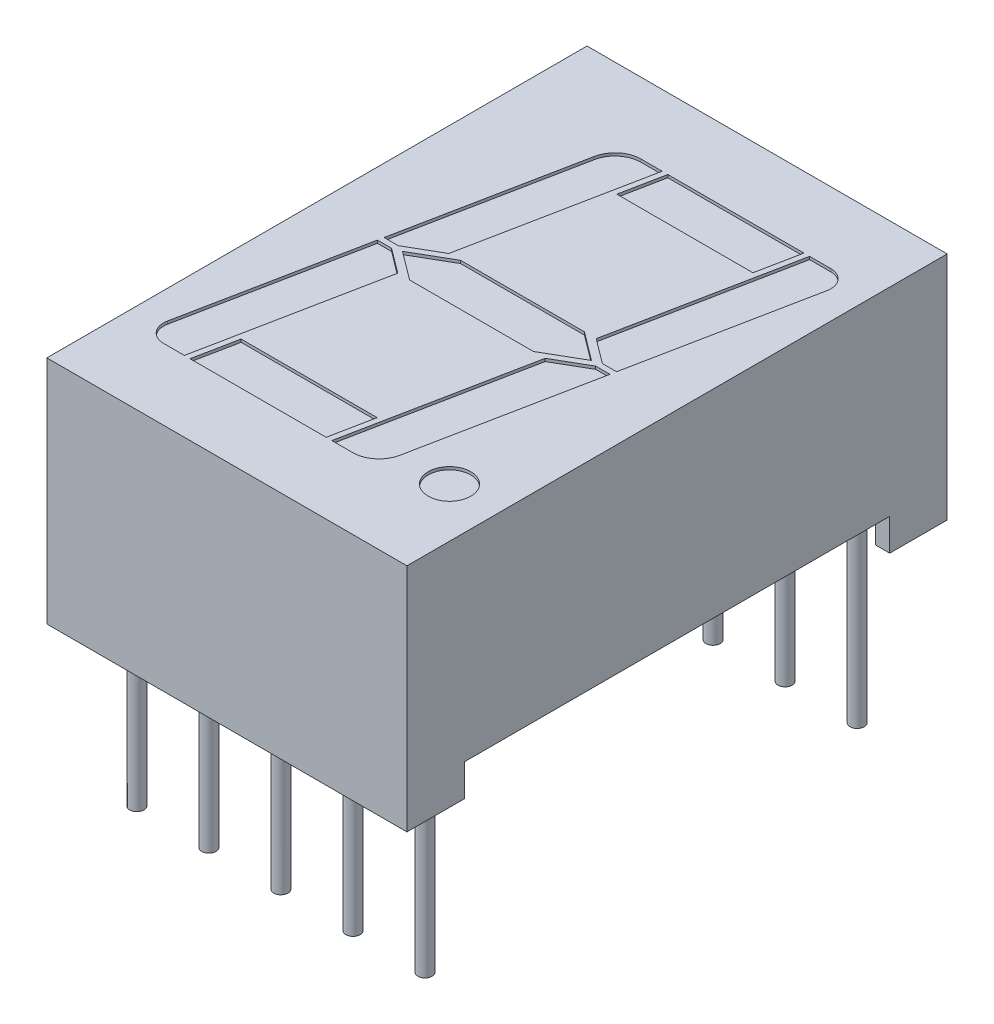
from build123d import *

# Parameters (mm, degrees)
SKETCH1_W                      = 12.7
SKETCH1_H                      = 19.05
BOSS_EXTRUDE1_DEPTH            = 8.128
SKETCH2_W                      = 15
SKETCH2_H                      = 1.128
CUT_EXTRUDE1_DEPTH             = 12.7
SKETCH3_W                      = 11.7
SKETCH3_H                      = 18.05
CUT_EXTRUDE2_DEPTH             = 0.5
CUT_EXTRUDE2_DIRECTION_2_REACH = 15.418
FILLET1_R                      = 1
FILLET2_R                      = 0.1
SKETCH4_R                      = 0.75
CUT_EXTRUDE3_DEPTH             = 0.1
SKETCH5_R                      = 0.25
BOSS_EXTRUDE2_DEPTH            = 7.5


with BuildPart() as part:
    # Sketch1 → Boss-Extrude1 (new body)
    with BuildSketch(Plane(origin=(0, 0, 0), x_dir=(1, 0, 0), z_dir=(0, 1, 0))):
        Rectangle(SKETCH1_W, SKETCH1_H)
    extrude(amount=-BOSS_EXTRUDE1_DEPTH)

    # Sketch2 → Cut-Extrude1 (cut)
    with BuildSketch(Plane(origin=(6.35, 0, 0), x_dir=(0, 0, -1), z_dir=(1, 0, 0))):
        with Locations((0, -7.564)):
            Rectangle(SKETCH2_W, SKETCH2_H)
    extrude(amount=-CUT_EXTRUDE1_DEPTH, mode=Mode.SUBTRACT)

    # Sketch3 → Cut-Extrude2 (cut)
    with BuildSketch(Plane.XZ.offset(7)):
        Rectangle(SKETCH3_W, SKETCH3_H)
    extrude(amount=-CUT_EXTRUDE2_DEPTH, mode=Mode.SUBTRACT)

    # Cut-Extrude2 direction 2: up to this face of the body (flat: up to its plane)
    cut_extrude2_direction_2_end = Plane(part.part.faces().sort_by_distance((0, -8.128, -8.5125))[0])
    # Sketch3 → Cut-Extrude2 direction 2 (cut, up to the picked face)
    with BuildSketch(Plane.XZ.offset(7), mode=Mode.PRIVATE) as cut_extrude2_direction_2_sk1:
        Rectangle(SKETCH3_W, SKETCH3_H)
    cut_extrude2_direction_2_tool1 = split(extrude(cut_extrude2_direction_2_sk1.sketch, amount=CUT_EXTRUDE2_DIRECTION_2_REACH, mode=Mode.PRIVATE), bisect_by=cut_extrude2_direction_2_end, keep=Keep.BOTH, mode=Mode.PRIVATE)
    add(cut_extrude2_direction_2_tool1.solids().sort_by(Axis((0, -7, 0), (0, -1, 0)))[0], mode=Mode.SUBTRACT)

    # Fillet1
    # the kernel refuses this fillet: 1 mm, written as the material it adds along each edge
    with BuildSketch(Plane(origin=(5.85, -6.5, 9.025), x_dir=(-1, 0, 0), z_dir=(0, 0, -1))) as fillet1_piece_1_section:
        with BuildLine():
            CenterArc((FILLET1_R, -FILLET1_R), FILLET1_R, 90, 90)
            Line((0, -FILLET1_R), (0, 0))
            Line((0, 0), (FILLET1_R, 0))
        make_face()
    fillet1_piece_1 = extrude(amount=18.05, mode=Mode.PRIVATE)
    fillet1_piece_1 = split(fillet1_piece_1, bisect_by=Plane(origin=(5.59487994, -7, 8.2625), z_dir=(0, 1, 0)), keep=Keep.TOP, mode=Mode.PRIVATE)
    fillet1_piece_1 = split(fillet1_piece_1, bisect_by=Plane(origin=(5.59487994, -6.664391764, 7.5), z_dir=(0, 0, 1)), keep=Keep.TOP, mode=Mode.PRIVATE)
    add(fillet1_piece_1)
    with BuildSketch(Plane(origin=(5.85, -6.5, 9.025), x_dir=(-1, 0, 0), z_dir=(0, 0, -1))) as fillet1_piece_2_section:
        with BuildLine():
            CenterArc((FILLET1_R, -FILLET1_R), FILLET1_R, 90, 90)
            Line((0, -FILLET1_R), (0, 0))
            Line((0, 0), (FILLET1_R, 0))
        make_face()
    fillet1_piece_2 = extrude(amount=18.05, mode=Mode.PRIVATE)
    fillet1_piece_2 = split(fillet1_piece_2, bisect_by=Plane(origin=(5.825991618, -7, 8.2625), z_dir=(0, -1, 0)), keep=Keep.TOP, mode=Mode.PRIVATE)
    fillet1_piece_2 = split(fillet1_piece_2, bisect_by=Plane(origin=(5.825991618, -7.163250785, 7.5), z_dir=(0, 0, 1)), keep=Keep.TOP, mode=Mode.PRIVATE)
    add(fillet1_piece_2)
    with BuildSketch(Plane(origin=(5.85, -6.5, 9.025), x_dir=(-1, 0, 0), z_dir=(0, 0, -1))) as fillet1_piece_3_section:
        with BuildLine():
            CenterArc((FILLET1_R, -FILLET1_R), FILLET1_R, 90, 90)
            Line((0, -FILLET1_R), (0, 0))
            Line((0, 0), (FILLET1_R, 0))
        make_face()
    fillet1_piece_3 = extrude(amount=18.05, mode=Mode.PRIVATE)
    fillet1_piece_3 = split(fillet1_piece_3, bisect_by=Plane(origin=(5.59487994, -6.664391764, -7.5), z_dir=(0, 0, 1)), keep=Keep.TOP, mode=Mode.PRIVATE)
    fillet1_piece_3 = split(fillet1_piece_3, bisect_by=Plane(origin=(5.59487994, -7, 0), z_dir=(0, 1, 0)), keep=Keep.TOP, mode=Mode.PRIVATE)
    fillet1_piece_3 = split(fillet1_piece_3, bisect_by=Plane(origin=(5.59487994, -6.664391764, 7.5), z_dir=(0, 0, -1)), keep=Keep.TOP, mode=Mode.PRIVATE)
    add(fillet1_piece_3)
    with BuildSketch(Plane(origin=(5.85, -6.5, 9.025), x_dir=(-1, 0, 0), z_dir=(0, 0, -1))) as fillet1_piece_4_section:
        with BuildLine():
            CenterArc((FILLET1_R, -FILLET1_R), FILLET1_R, 90, 90)
            Line((0, -FILLET1_R), (0, 0))
            Line((0, 0), (FILLET1_R, 0))
        make_face()
    fillet1_piece_4 = extrude(amount=18.05, mode=Mode.PRIVATE)
    fillet1_piece_4 = split(fillet1_piece_4, bisect_by=Plane(origin=(5.59487994, -6.664391764, -7.5), z_dir=(0, 0, -1)), keep=Keep.TOP, mode=Mode.PRIVATE)
    fillet1_piece_4 = split(fillet1_piece_4, bisect_by=Plane(origin=(5.59487994, -7, -8.2625), z_dir=(0, 1, 0)), keep=Keep.TOP, mode=Mode.PRIVATE)
    add(fillet1_piece_4)
    with BuildSketch(Plane(origin=(5.85, -6.5, 9.025), x_dir=(-1, 0, 0), z_dir=(0, 0, -1))) as fillet1_piece_5_section:
        with BuildLine():
            CenterArc((FILLET1_R, -FILLET1_R), FILLET1_R, 90, 90)
            Line((0, -FILLET1_R), (0, 0))
            Line((0, 0), (FILLET1_R, 0))
        make_face()
    fillet1_piece_5 = extrude(amount=18.05, mode=Mode.PRIVATE)
    fillet1_piece_5 = split(fillet1_piece_5, bisect_by=Plane(origin=(5.825991618, -7.163250785, -7.5), z_dir=(0, 0, -1)), keep=Keep.TOP, mode=Mode.PRIVATE)
    fillet1_piece_5 = split(fillet1_piece_5, bisect_by=Plane(origin=(5.825991618, -7, -8.2625), z_dir=(0, -1, 0)), keep=Keep.TOP, mode=Mode.PRIVATE)
    add(fillet1_piece_5)
    with BuildSketch(Plane(origin=(5.85, -6.5, -9.025), x_dir=(0, 0, 1), z_dir=(-1, 0, 0))) as fillet1_piece_6:
        with BuildLine():
            CenterArc((FILLET1_R, -FILLET1_R), FILLET1_R, 90, 90)
            Line((0, -FILLET1_R), (0, 0))
            Line((0, 0), (FILLET1_R, 0))
        make_face()
    extrude(amount=11.7)
    with BuildSketch(Plane(origin=(-5.85, -6.5, -9.025), x_dir=(1, 0, 0), z_dir=(0, 0, 1))) as fillet1_piece_7_section:
        with BuildLine():
            CenterArc((FILLET1_R, -FILLET1_R), FILLET1_R, 90, 90)
            Line((0, -FILLET1_R), (0, 0))
            Line((0, 0), (FILLET1_R, 0))
        make_face()
    fillet1_piece_7 = extrude(amount=18.05, mode=Mode.PRIVATE)
    fillet1_piece_7 = split(fillet1_piece_7, bisect_by=Plane(origin=(-5.59487994, -7, -8.2625), z_dir=(0, 1, 0)), keep=Keep.TOP, mode=Mode.PRIVATE)
    fillet1_piece_7 = split(fillet1_piece_7, bisect_by=Plane(origin=(-5.59487994, -6.664391764, -7.5), z_dir=(0, 0, -1)), keep=Keep.TOP, mode=Mode.PRIVATE)
    add(fillet1_piece_7)
    with BuildSketch(Plane(origin=(-5.85, -6.5, -9.025), x_dir=(1, 0, 0), z_dir=(0, 0, 1))) as fillet1_piece_8_section:
        with BuildLine():
            CenterArc((FILLET1_R, -FILLET1_R), FILLET1_R, 90, 90)
            Line((0, -FILLET1_R), (0, 0))
            Line((0, 0), (FILLET1_R, 0))
        make_face()
    fillet1_piece_8 = extrude(amount=18.05, mode=Mode.PRIVATE)
    fillet1_piece_8 = split(fillet1_piece_8, bisect_by=Plane(origin=(-5.825991618, -7, -8.2625), z_dir=(0, -1, 0)), keep=Keep.TOP, mode=Mode.PRIVATE)
    fillet1_piece_8 = split(fillet1_piece_8, bisect_by=Plane(origin=(-5.825991618, -7.163250785, -7.5), z_dir=(0, 0, -1)), keep=Keep.TOP, mode=Mode.PRIVATE)
    add(fillet1_piece_8)
    with BuildSketch(Plane(origin=(-5.85, -6.5, -9.025), x_dir=(1, 0, 0), z_dir=(0, 0, 1))) as fillet1_piece_9_section:
        with BuildLine():
            CenterArc((FILLET1_R, -FILLET1_R), FILLET1_R, 90, 90)
            Line((0, -FILLET1_R), (0, 0))
            Line((0, 0), (FILLET1_R, 0))
        make_face()
    fillet1_piece_9 = extrude(amount=18.05, mode=Mode.PRIVATE)
    fillet1_piece_9 = split(fillet1_piece_9, bisect_by=Plane(origin=(-5.59487994, -6.664391764, 7.5), z_dir=(0, 0, -1)), keep=Keep.TOP, mode=Mode.PRIVATE)
    fillet1_piece_9 = split(fillet1_piece_9, bisect_by=Plane(origin=(-5.59487994, -7, 0), z_dir=(0, 1, 0)), keep=Keep.TOP, mode=Mode.PRIVATE)
    fillet1_piece_9 = split(fillet1_piece_9, bisect_by=Plane(origin=(-5.59487994, -6.664391764, -7.5), z_dir=(0, 0, 1)), keep=Keep.TOP, mode=Mode.PRIVATE)
    add(fillet1_piece_9)
    with BuildSketch(Plane(origin=(-5.85, -6.5, -9.025), x_dir=(1, 0, 0), z_dir=(0, 0, 1))) as fillet1_piece_10_section:
        with BuildLine():
            CenterArc((FILLET1_R, -FILLET1_R), FILLET1_R, 90, 90)
            Line((0, -FILLET1_R), (0, 0))
            Line((0, 0), (FILLET1_R, 0))
        make_face()
    fillet1_piece_10 = extrude(amount=18.05, mode=Mode.PRIVATE)
    fillet1_piece_10 = split(fillet1_piece_10, bisect_by=Plane(origin=(-5.59487994, -6.664391764, 7.5), z_dir=(0, 0, 1)), keep=Keep.TOP, mode=Mode.PRIVATE)
    fillet1_piece_10 = split(fillet1_piece_10, bisect_by=Plane(origin=(-5.59487994, -7, 8.2625), z_dir=(0, 1, 0)), keep=Keep.TOP, mode=Mode.PRIVATE)
    add(fillet1_piece_10)
    with BuildSketch(Plane(origin=(-5.85, -6.5, -9.025), x_dir=(1, 0, 0), z_dir=(0, 0, 1))) as fillet1_piece_11_section:
        with BuildLine():
            CenterArc((FILLET1_R, -FILLET1_R), FILLET1_R, 90, 90)
            Line((0, -FILLET1_R), (0, 0))
            Line((0, 0), (FILLET1_R, 0))
        make_face()
    fillet1_piece_11 = extrude(amount=18.05, mode=Mode.PRIVATE)
    fillet1_piece_11 = split(fillet1_piece_11, bisect_by=Plane(origin=(-5.825991618, -7.163250785, 7.5), z_dir=(0, 0, 1)), keep=Keep.TOP, mode=Mode.PRIVATE)
    fillet1_piece_11 = split(fillet1_piece_11, bisect_by=Plane(origin=(-5.825991618, -7, 8.2625), z_dir=(0, -1, 0)), keep=Keep.TOP, mode=Mode.PRIVATE)
    add(fillet1_piece_11)
    with BuildSketch(Plane(origin=(-5.85, -6.5, 9.025), x_dir=(0, -1, 0), z_dir=(1, 0, 0))) as fillet1_piece_12:
        with BuildLine():
            CenterArc((FILLET1_R, FILLET1_R), FILLET1_R, 180, 90)
            Line((0, FILLET1_R), (0, 0))
            Line((0, 0), (FILLET1_R, 0))
        make_face()
    extrude(amount=11.7)

    # Fillet2
    fillet2_edges = [part.edges().sort_by_distance(p)[0] for p in [
        (-5.85, -7.814, 9.025),
        (5.85, -7.814, -9.025),
        (-5.85, -7.814, -9.025),
        (5.85, -7.814, 9.025),
        (-5.32248141, -6.618659364, -8.49748141),
        (-5.496048907, -6.736703983, 8.671048907),
        (5.496048907, -6.736703983, -8.671048907),
        (5.496048907, -6.736703983, 8.671048907),
    ]]
    fillet(fillet2_edges, radius=FILLET2_R)

    # Sketch4 → Cut-Extrude3 (cut)
    with BuildSketch(Plane(origin=(0, 0, 0), x_dir=(1, 0, 0), z_dir=(0, 1, 0))):
        with Locations(Location((4.6, -6.275, 0), (0, 0, 270))):
            Circle(SKETCH4_R)
        Polygon((3.79940239, 7.025), (3.50059761, 5.525), (-1.29940239, 5.525), (-1.00059761, 7.025), align=None)
        Polygon((1.29940239, -5.525), (1.00059761, -7.025), (-3.79940239, -7.025), (-3.50059761, -5.525), align=None)
        with BuildLine():
            Line((2.45059761, -0.75), (1.20059761, -7.025))
            Line((1.20059761, -7.025), (1.95059761, -7.025))
            ThreePointArc((1.95059761, -7.025), (2.532760738, -6.808848773), (2.85, -6.275))
            Line((2.85, -6.275), (4.080463533, -0.098073067))
            Line((4.080463533, -0.098073067), (3.580463533, -0.098073067))
            Line((3.580463533, -0.098073067), (2.45059761, -0.75))
        make_face()
        with BuildLine():
            Line((-2.74940239, -0.75), (-3.99940239, -7.025))
            Line((-3.99940239, -7.025), (-4.74940239, -7.025))
            ThreePointArc((-4.74940239, -7.025), (-5.224381992, -6.789883825), (-5.35, -6.275))
            Line((-5.35, -6.275), (-4.119536467, -0.098073067))
            Line((-4.119536467, -0.098073067), (-3.619536467, -0.098073067))
            Line((-3.619536467, -0.098073067), (-2.74940239, -0.75))
        make_face()
        with BuildLine():
            Line((2.74940239, 0.75), (3.99940239, 7.025))
            Line((3.99940239, 7.025), (4.74940239, 7.025))
            ThreePointArc((4.74940239, 7.025), (5.229823427, 6.794241309), (5.35, 6.275))
            Line((5.35, 6.275), (4.119536467, 0.098073067))
            Line((4.119536467, 0.098073067), (3.619536467, 0.098073067))
            Line((3.619536467, 0.098073067), (2.74940239, 0.75))
        make_face()
        with BuildLine():
            Line((-2.45059761, 0.75), (-1.20059761, 7.025))
            Line((-1.20059761, 7.025), (-1.95059761, 7.025))
            ThreePointArc((-1.95059761, 7.025), (-2.536136818, 6.812897379), (-2.85, 6.275))
            Line((-2.85, 6.275), (-4.080463533, 0.098073067))
            Line((-4.080463533, 0.098073067), (-3.580463533, 0.098073067))
            Line((-3.580463533, 0.098073067), (-2.45059761, 0.75))
        make_face()
        Polygon((-2.03365535, 0.75), (2.332460131, 0.75), (3.333493413, 0), (2.03365535, -0.75), (-2.332460131, -0.75), (-3.333493413, 0), align=None)
    extrude(amount=-CUT_EXTRUDE3_DEPTH, mode=Mode.SUBTRACT)

    # Sketch5 → Boss-Extrude2 (add)
    with BuildSketch(Plane.XZ.offset(6.5)):
        with Locations(Location((-5.08, 7.62, 0), (0, 0, 90))):
            Circle(SKETCH5_R)
        with Locations(Location((-2.54, 7.62, 0), (0, 0, 90))):
            Circle(SKETCH5_R)
        with Locations(Location((0, 7.62, 0), (0, 0, 90))):
            Circle(SKETCH5_R)
        with Locations(Location((2.54, 7.62, 0), (0, 0, 90))):
            Circle(SKETCH5_R)
        with Locations(Location((5.08, 7.62, 0), (0, 0, 90))):
            Circle(SKETCH5_R)
        with Locations(Location((-5.08, -7.62, 0), (0, 0, 90))):
            Circle(SKETCH5_R)
        with Locations(Location((-2.54, -7.62, 0), (0, 0, 90))):
            Circle(SKETCH5_R)
        with Locations(Location((0, -7.62, 0), (0, 0, 90))):
            Circle(SKETCH5_R)
        with Locations(Location((2.54, -7.62, 0), (0, 0, 90))):
            Circle(SKETCH5_R)
        with Locations(Location((5.08, -7.62, 0), (0, 0, 90))):
            Circle(SKETCH5_R)
    extrude(amount=BOSS_EXTRUDE2_DEPTH)


solid = part.part
